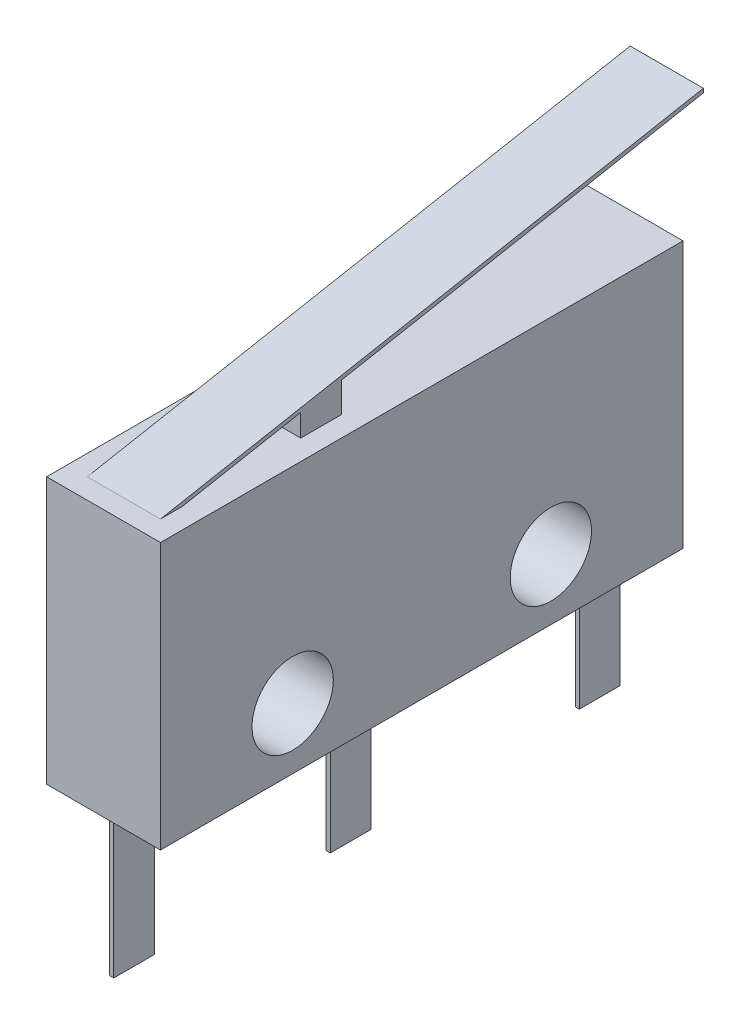
from build123d import *

# Parameters (mm, degrees)
BODYSKETCH1_W                = 12.85
BODYSKETCH1_H                = 6.55
BODYSKETCH1_R                = 1
BODYBOSS_EXTRUDE1_DEPTH      = 2.8
SKETCH2_W                    = 1.8
SKETCH2_H                    = 13.35
LEVERBOSS_EXTRUDE2_DEPTH     = 2.5
LEVERCUT_EXTRUDE1_DEPTH      = 17.703742096
BUTTONBOSS_EXTRUDE3_REACH    = 17.574
SKETCH4_W                    = 1.8
SKETCH4_H                    = 1
SKETCH5_W                    = 0.1
SKETCH5_H                    = 1
TEREMINALBOSS_EXTRUDE4_DEPTH = 3.5


with BuildPart() as part:
    # BodySketch1 → BodyBoss-Extrude1 (new body)
    with BuildSketch(Plane(origin=(0, 0, 0), x_dir=(0, 0, -1), z_dir=(1, 0, 0))):
        with Locations((6.425, 3.275)):
            Rectangle(BODYSKETCH1_W, BODYSKETCH1_H)
        with Locations((3.25, 1.5)):
            Circle(BODYSKETCH1_R, mode=Mode.SUBTRACT)
        with Locations((9.6, 1.5)):
            Circle(BODYSKETCH1_R, mode=Mode.SUBTRACT)
    extrude(amount=BODYBOSS_EXTRUDE1_DEPTH)

    # Sketch2 → LeverBoss-Extrude2 (add)
    with BuildSketch(Plane(origin=(0, 6.55, 0), x_dir=(1, 0, 0), z_dir=(0, 1, 0))):
        with Locations((1.4, 7.175)):
            Rectangle(SKETCH2_W, SKETCH2_H)
    extrude(amount=LEVERBOSS_EXTRUDE2_DEPTH)

    # Sketch3 → LeverCut-Extrude1 (cut, through all)
    with BuildSketch(Plane(origin=(2.3, 0, 0), x_dir=(0, 0, -1), z_dir=(1, 0, 0))):
        Polygon((0.5, 6.55), (13.85, 9.05), (0.5, 9.05), align=None)
        Polygon((13.85, 8.95), (13.85, 6.55), (1.034, 6.55), align=None)
    extrude(amount=-LEVERCUT_EXTRUDE1_DEPTH, mode=Mode.SUBTRACT)

    # Sketch4 → ButtonBoss-Extrude3 (add, up to next)
    with BuildSketch(Plane(origin=(0, 6.55, 0), x_dir=(1, 0, 0), z_dir=(0, 1, 0)), mode=Mode.PRIVATE) as buttonboss_extrude3_sk1:
        with Locations((1.4, 4.448948019)):
            Rectangle(SKETCH4_W, SKETCH4_H)
    buttonboss_extrude3_tool1 = extrude(buttonboss_extrude3_sk1.sketch, amount=BUTTONBOSS_EXTRUDE3_REACH, mode=Mode.PRIVATE) - part.part
    add(buttonboss_extrude3_tool1.solids().sort_by_distance((1.4, 6.55, -4.448948))[0])

    # Sketch5 → TereminalBoss-Extrude4 (add)
    with BuildSketch(Plane.XZ):
        with Locations((1.4, -0.7)):
            Rectangle(SKETCH5_W, SKETCH5_H)
        with Locations((1.4, -6.025)):
            Rectangle(SKETCH5_W, SKETCH5_H)
        with Locations((1.4, -12.15)):
            Rectangle(SKETCH5_W, SKETCH5_H)
    extrude(amount=TEREMINALBOSS_EXTRUDE4_DEPTH)


solid = part.part
